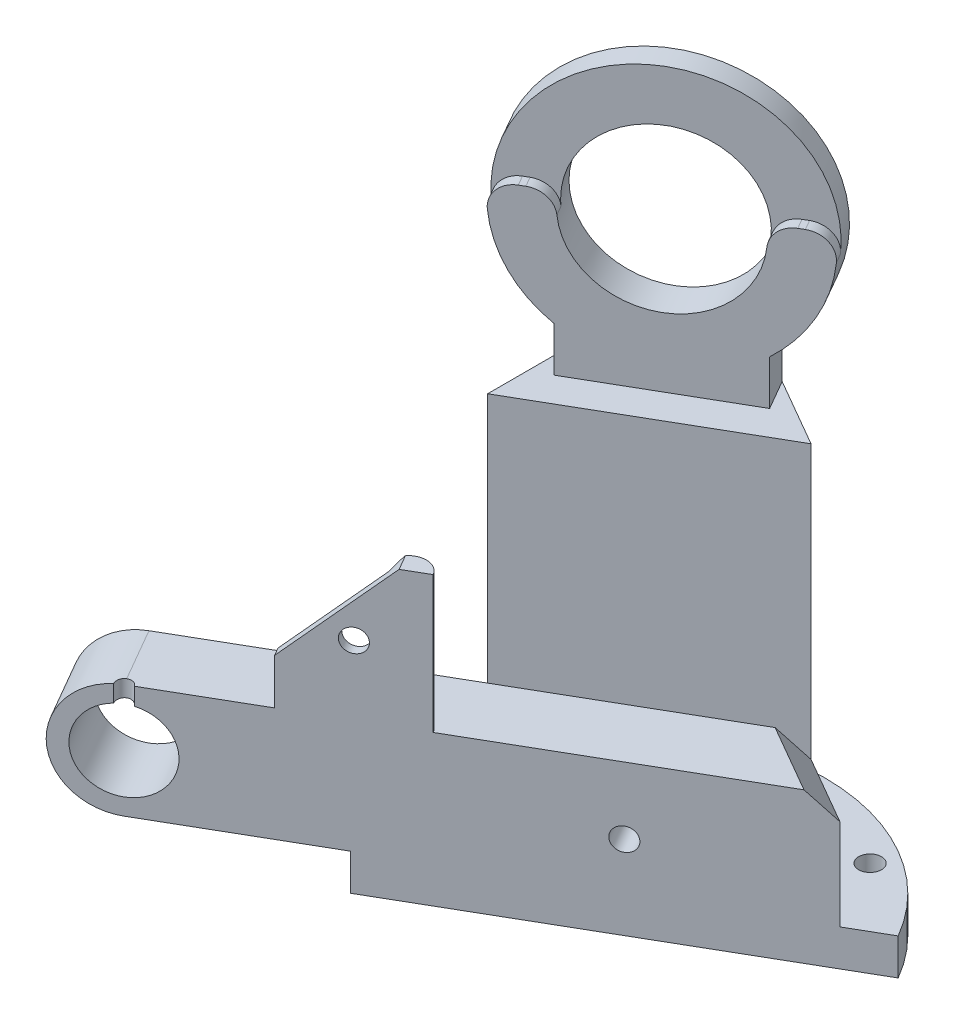
from build123d import *

# Parameters (mm, degrees)
SKETCH4_R            = 55.88
BOSS_EXTRUDE2_DEPTH  = 10.16
BOSS_EXTRUDE4_DEPTH  = 101.6
BOSS_EXTRUDE5_DEPTH  = 9.525
BOSS_EXTRUDE6_START  = -9.525
BOSS_EXTRUDE6_DEPTH  = 9.525
CUT_EXTRUDE4_REACH   = 223.16
SKETCH12_R           = 21.5
SKETCH13_W           = 38.1
SKETCH13_H           = 69.85
CUT_EXTRUDE5_DEPTH   = 76.2
BOSS_EXTRUDE10_DEPTH = 19.05
SKETCH28_R           = 11.2395
CUT_EXTRUDE9_DEPTH   = 38.1
CUT_EXTRUDE10_DEPTH  = 7.366
CHAMFER1_SIZE        = 6.35
SKETCH30_R           = 2.1
CUT_EXTRUDE11_DEPTH  = 7.366
SKETCH31_R           = 3.175
CUT_EXTRUDE12_DEPTH  = 223.900333216
BOSS_EXTRUDE11_DEPTH = 38.1
CHAMFER2_SIZE        = 25.4
CUT_EXTRUDE13_REACH  = 233.204
SKETCH34_R           = 3.175
SKETCH35_R           = 3.175
CUT_EXTRUDE14_DEPTH  = 246.746626534
SKETCH36_W           = 63.5
SKETCH36_H           = 36.709955102
CUT_EXTRUDE15_DEPTH  = 63.5
FILLET1_R            = 6.35
SKETCH37_W           = 210.742334846
SKETCH37_H           = 201.224939079
CUT_EXTRUDE16_DEPTH  = 232.093968202


with BuildPart() as part:
    # Sketch4 → Boss-Extrude2 (new body)
    with BuildSketch(Plane(origin=(0, 0, 0), x_dir=(1, 0, 0), z_dir=(0, 1, 0))):
        with Locations(Location((0, 0, 0), (0, 0, 270))):
            Circle(SKETCH4_R)
    extrude(amount=BOSS_EXTRUDE2_DEPTH)

    # Sketch8 → Boss-Extrude4 (add)
    with BuildSketch(Plane(origin=(0, 10.16, 0), x_dir=(1, 0, 0), z_dir=(0, 1, 0))):
        Polygon((0, 43.994090512), (-38.1, 21.997045256), (-38.1, -21.997045256), (0, -43.994090512), (38.1, -21.997045256), (38.1, 21.997045256), align=None)
    extrude(amount=BOSS_EXTRUDE4_DEPTH)

    # Sketch9 → Boss-Extrude5 (add)
    with BuildSketch(Plane(origin=(-19.05, 0, -32.995567884), x_dir=(-0.8660254037844386, 0, 0.5000000000000003), z_dir=(-0.5000000000000002, 0, -0.8660254037844385))):
        with BuildLine():
            Line((21.997045256, 111.76), (-21.997045256, 111.76))
            Line((-21.997045256, 111.76), (-21.997045256, 124.225996336))
            ThreePointArc((-21.997045256, 124.225996336), (0, 188.144153123), (21.997045256, 124.225996336))
            Line((21.997045256, 124.225996336), (21.997045256, 111.76))
        make_face()
    extrude(amount=-BOSS_EXTRUDE5_DEPTH)

    # Sketch10 → Boss-Extrude6 (add)
    with BuildSketch(Plane(origin=(19.05, 0, 32.995567884), x_dir=(0.8660254037844386, 0, -0.5000000000000001), z_dir=(0.5000000000000001, 0, 0.8660254037844386)).offset(BOSS_EXTRUDE6_START)):
        with BuildLine():
            Line((-21.997045256, 111.76), (21.997045256, 111.76))
            Line((21.997045256, 111.76), (21.997045256, 124.225996336))
            ThreePointArc((21.997045256, 124.225996336), (0, 188.144153123), (-21.997045256, 124.225996336))
            Line((-21.997045256, 124.225996336), (-21.997045256, 111.76))
        make_face()
    extrude(amount=BOSS_EXTRUDE6_DEPTH)

    # Cut-Extrude4: up to this face of the body (flat: up to its plane)
    cut_extrude4_end = Plane(part.part.faces().sort_by_distance((19.05, 104.643172711, 32.995567884))[0])
    # Sketch12 → Cut-Extrude4 (cut, up to the picked face)
    with BuildSketch(Plane(origin=(-19.05, 0, -32.995567884), x_dir=(-0.8660254037844386, 0, 0.5000000000000003), z_dir=(-0.5000000000000002, 0, -0.8660254037844385)), mode=Mode.PRIVATE) as cut_extrude4_sk1:
        with Locations((0, 152.4)):
            Circle(SKETCH12_R)
    cut_extrude4_tool1 = split(extrude(cut_extrude4_sk1.sketch, amount=-CUT_EXTRUDE4_REACH, mode=Mode.PRIVATE), bisect_by=cut_extrude4_end, keep=Keep.BOTH, mode=Mode.PRIVATE)
    add(cut_extrude4_tool1.solids().sort_by(Axis((-19.05, 152.4, -32.995568), (0.5000000000000002, 0, 0.8660254037844385)))[0], mode=Mode.SUBTRACT)

    # Sketch13 → Cut-Extrude5 (cut, symmetric)
    with BuildSketch(Plane(origin=(-19.05, 0, 10.998522628), x_dir=(0.5000000000000002, 0, 0.8660254037844386), z_dir=(-0.8660254037844385, 0, 0.5000000000000001))):
        with Locations((0, 76.835)):
            Rectangle(SKETCH13_W, SKETCH13_H)
    extrude(amount=CUT_EXTRUDE5_DEPTH, both=True, mode=Mode.SUBTRACT)

    # Sketch22 → Boss-Extrude10 (add, symmetric)
    with BuildSketch(Plane(origin=(0, 0, 0), x_dir=(-0.8660254037844386, 0, 0.5000000000000001), z_dir=(-0.5000000000000001, 0, -0.8660254037844386))):
        with BuildLine():
            Line((43.994090512, 41.91), (102.10102108, 41.91))
            ThreePointArc((102.10102108, 41.91), (117.97602108, 26.035), (102.10102108, 10.16))
            Line((102.10102108, 10.16), (43.994090512, 10.16))
            Line((43.994090512, 10.16), (21.997045256, 10.16))
            Line((21.997045256, 10.16), (21.997045256, 41.91))
            Line((21.997045256, 41.91), (43.994090512, 41.91))
        make_face()
    extrude(amount=BOSS_EXTRUDE10_DEPTH, both=True)

    # Sketch28 → Cut-Extrude9 (cut)
    with BuildSketch(Plane(origin=(9.525, 0, 16.497783942), x_dir=(0.8660254037844386, 0, -0.5000000000000001), z_dir=(0.5000000000000001, 0, 0.8660254037844386))):
        with Locations((-102.10102108, 26.035)):
            Circle(SKETCH28_R)
    extrude(amount=-CUT_EXTRUDE9_DEPTH, mode=Mode.SUBTRACT)

    # Sketch29 → Cut-Extrude10 (cut)
    with BuildSketch(Plane(origin=(9.525, 0, 16.497783942), x_dir=(0.8660254037844386, 0, -0.5000000000000001), z_dir=(0.5000000000000001, 0, 0.8660254037844386))):
        with BuildLine():
            Line((-115.737415068, 17.907), (-109.863879848, 17.907))
            ThreePointArc((-109.863879848, 17.907), (-113.34052108, 26.035), (-109.863879848, 34.163))
            Line((-109.863879848, 34.163), (-115.737415068, 34.163))
            ThreePointArc((-115.737415068, 34.163), (-117.97602108, 26.035), (-115.737415068, 17.907))
        make_face()
    extrude(amount=-CUT_EXTRUDE10_DEPTH, mode=Mode.SUBTRACT)

    # Chamfer1
    chamfer1_edges = [part.edges().sort_by_distance(p)[0] for p in [
        (38.1, 41.91, -10.998522628),
        (28.575, 41.91, -27.49630657),
    ]]
    chamfer(chamfer1_edges, length=CHAMFER1_SIZE)

    # Sketch30 → Cut-Extrude11 (cut)
    with BuildSketch(Plane(origin=(0, 41.91, 0), x_dir=(1, 0, 0), z_dir=(0, 1, 0))):
        with Locations(Location((-88.422078008, -51.05051054, 0), (0, 0, 270))):
            Circle(SKETCH30_R)
    extrude(amount=-CUT_EXTRUDE11_DEPTH, mode=Mode.SUBTRACT)

    # Sketch31 → Cut-Extrude12 (cut, through all)
    with BuildSketch(Plane(origin=(0, 10.16, 0), x_dir=(1, 0, 0), z_dir=(0, 1, 0))):
        with Locations(Location((-49.089000823, 6.594762938, 0), (0, 0, 270))):
            Circle(SKETCH31_R)
        with Locations(Location((26.925278647, 41.57222955, 0), (0, 0, 270))):
            Circle(SKETCH31_R)
    cut_extrude12 = extrude(amount=-CUT_EXTRUDE12_DEPTH, mode=Mode.SUBTRACT)

    # Mirror1: Cut-Extrude12 across plane
    add(cut_extrude12.mirror(Plane(origin=(0, 0, 0), x_dir=(-0.8660254037844386, 0, 0.5000000000000001), z_dir=(-0.5000000000000001, 0, -0.8660254037844386))), mode=Mode.SUBTRACT)

    # Sketch33 → Boss-Extrude11 (add)
    with BuildSketch(Plane(origin=(0, 41.91, 0), x_dir=(1, 0, 0), z_dir=(0, 1, 0))):
        with BuildLine():
            Line((-43.411916389, -22.079834386), (-63.092428819, -33.442383535))
            Line((-63.092428819, -33.442383535), (-61.800298466, -35.680418955))
            Line((-61.800298466, -35.680418955), (-60.542722832, -37.858603849))
            Line((-60.542722832, -37.858603849), (-40.91541904, -26.504074545))
            ThreePointArc((-40.91541904, -26.504074545), (-33.742060338, -19.539834386), (-43.411916389, -22.079834386))
        make_face()
    extrude(amount=BOSS_EXTRUDE11_DEPTH)

    # Chamfer2
    chamfer2_edges = [part.edges().sort_by_distance(p)[0] for p in [
        (-61.817575825, 80.01, 35.650493692),
    ]]
    chamfer(chamfer2_edges, length=CHAMFER2_SIZE)

    # Cut-Extrude13: up to this plane
    cut_extrude13_end = Plane(origin=(-60.542722832, 80.01, 37.858603849), z_dir=(-0.500750644235671, 0, -0.8655915851587056))
    # Sketch34 → Cut-Extrude13 (cut, up to the surface)
    with BuildSketch(Plane(origin=(-1.292130352, 0, -2.23803542), x_dir=(-0.8660254037844386, 0, 0.5000000000000003), z_dir=(-0.5000000000000002, 0, -0.8660254037844385)), mode=Mode.PRIVATE) as cut_extrude13_sk1:
        with Locations((55.184849848, 61.159110234)):
            Circle(SKETCH34_R)
    cut_extrude13_tool1 = split(extrude(cut_extrude13_sk1.sketch, amount=-CUT_EXTRUDE13_REACH, mode=Mode.PRIVATE), bisect_by=cut_extrude13_end, keep=Keep.BOTH, mode=Mode.PRIVATE)
    add(cut_extrude13_tool1.solids().sort_by_distance((-49.083612, 61.15911, 25.35439))[0], mode=Mode.SUBTRACT)

    # Sketch35 → Cut-Extrude14 (cut, through all)
    with BuildSketch(Plane(origin=(19.05, 0, 32.995567884), x_dir=(0.8660254037844386, 0, -0.5000000000000001), z_dir=(0.5000000000000001, 0, 0.8660254037844386))):
        with Locations((0, 23.280078313)):
            Circle(SKETCH35_R)
    extrude(amount=-CUT_EXTRUDE14_DEPTH, mode=Mode.SUBTRACT)

    # Sketch36 → Cut-Extrude15 (cut, symmetric)
    with BuildSketch(Plane(origin=(-19.05, 0, 10.998522628), x_dir=(0.5000000000000004, 0, 0.8660254037844384), z_dir=(-0.8660254037844384, 0, 0.5000000000000004))):
        with Locations((0, 174.660846527)):
            Rectangle(SKETCH36_W, SKETCH36_H)
    extrude(amount=CUT_EXTRUDE15_DEPTH, both=True, mode=Mode.SUBTRACT)

    # Fillet1
    # the kernel refuses this fillet: 6.35 mm, written as the material it takes off along each edge
    with BuildSketch(Plane(origin=(12.272597523, 156.305868976, -21.027711652), x_dir=(0.04103819462533737, -0.9988766133891899, -0.023693412713994805), z_dir=(-0.5000000000000003, 0, -0.8660254037844386))) as fillet1_piece_1:
        with BuildLine():
            CenterArc((6.655634068, -6.291985478), FILLET1_R, 97.750867839, 84.965214409)
            Line((0.312767573, -6.592891819), (0, 0))
            ThreePointArc((0, 0), (2.899617679, -0.196427123), (5.799235358, 0))
        make_face()
    extrude(amount=19.675766287, mode=Mode.SUBTRACT)
    with BuildSketch(Plane(origin=(-24.346831236, 156.305868976, 0.114525399), x_dir=(-0.04103819462533767, -0.9988766133891899, 0.023693412713994975), z_dir=(-0.5000000000000003, 0, -0.8660254037844386))) as fillet1_piece_2:
        with BuildLine():
            CenterArc((6.655634068, 6.291985478), FILLET1_R, 177.283917752, 84.965214409)
            Line((0.312767573, 6.592891819), (0, 0))
            ThreePointArc((0, 0), (2.899617679, 0.196427123), (5.799235358, 0))
        make_face()
    extrude(amount=19.675766287, mode=Mode.SUBTRACT)
    with BuildSketch(Plane(origin=(-14.894977291, 156.305868976, 45.261361242), x_dir=(-0.011364190914464473, -0.999913899736612, 0.0065611186835884), z_dir=(-0.5000000000000002, 0, -0.8660254037844386)), Plane(origin=(-36.459231913, 156.305868976, 7.91097661), x_dir=(-0.011364190914463116, -0.999913899736612, 0.0065611186835876165), z_dir=(-0.5000000000000002, 0, -0.8660254037844386))) as fillet1_piece_3:
        with BuildLine():
            CenterArc((6.26760006, -6.320536654), FILLET1_R, 84.478464497, 94.769665105)
            Line((-0.081853204, -6.237210446), (0, 0))
            ThreePointArc((0, 0), (3.439298151, 0.165849191), (6.878596303, 0))
        make_face()
    extrude(amount=20.371490756, mode=Mode.SUBTRACT)
    with BuildSketch(Plane(origin=(25.080722669, 156.305868976, -27.619132734), x_dir=(0.011364190914465366, -0.999913899736612, -0.00656111868358885), z_dir=(-0.5000000000000002, 0, -0.8660254037844386)), Plane(origin=(46.644977291, 156.305868976, 9.731251898), x_dir=(0.011364190914466365, -0.999913899736612, -0.006561118683589426), z_dir=(-0.5000000000000002, 0, -0.8660254037844386))) as fillet1_piece_4:
        with BuildLine():
            CenterArc((6.26760006, 6.320536654), FILLET1_R, 180.751870398, 94.769665105)
            Line((-0.081853204, 6.237210446), (0, 0))
            ThreePointArc((0, 0), (3.439298151, -0.165849191), (6.878596303, 0))
        make_face()
    extrude(amount=20.371490756, mode=Mode.SUBTRACT)

    # Sketch37 → Cut-Extrude16 (cut, through all)
    with BuildSketch(Plane(origin=(0, 0, 0), x_dir=(-0.8660254037844386, 0, 0.5000000000000001), z_dir=(-0.5000000000000001, 0, -0.8660254037844386))):
        with Locations((30.487295463, 97.29801522)):
            Rectangle(SKETCH37_W, SKETCH37_H)
    extrude(amount=-CUT_EXTRUDE16_DEPTH, mode=Mode.SUBTRACT)


solid = part.part
